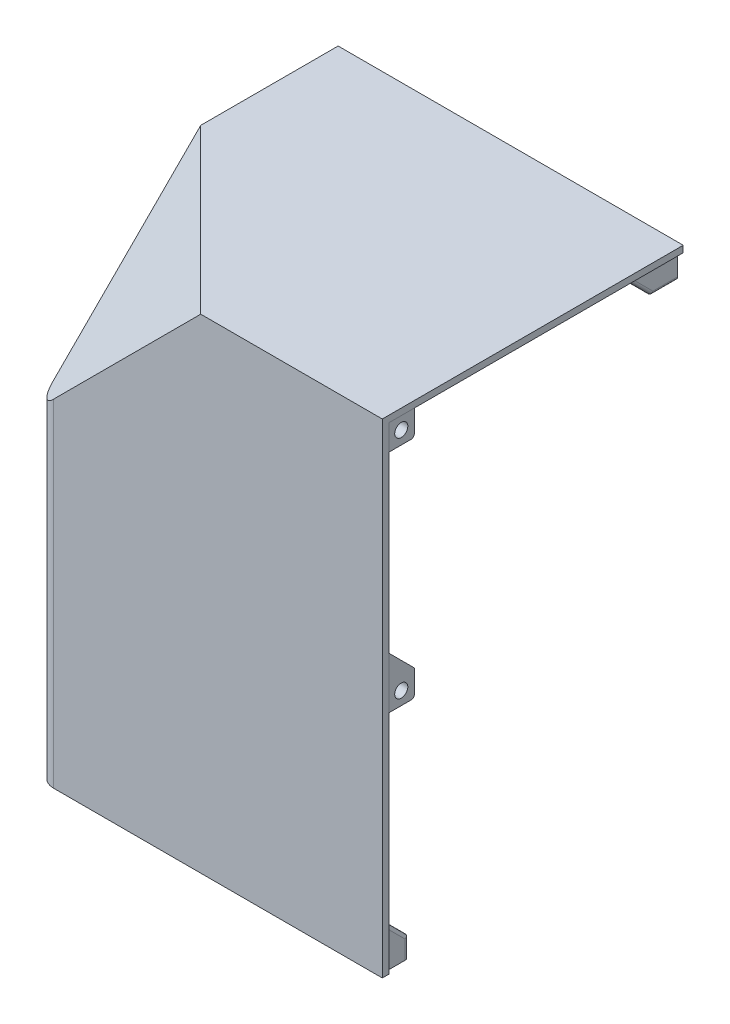
from build123d import *

# Parameters (mm, degrees)
BOSS_EXTRUDE1_DEPTH       = 146
SKETCH2_W                 = 105.5
SKETCH2_H                 = 92
BOSS_EXTRUDE2_DEPTH       = 2
BOSS_EXTRUDE3_START       = -0.2
SKETCH3_W                 = 7
SKETCH3_H                 = 8
SKETCH3_R                 = 2
SKETCH3_W_2               = 8
BOSS_EXTRUDE3_DEPTH       = 6
SKETCH4_W                 = 8
SKETCH4_H                 = 8
BOSS_EXTRUDE4_DEPTH       = 8
SKETCH5_W                 = 8
SKETCH5_H                 = 77
CUT_EXTRUDE1_DEPTH        = 0.2
F_4_0MM_DOWEL_HOLE1_D     = 4
F_4_0MM_DOWEL_HOLE1_DEPTH = 7.8
CHAMFER2_SIZE             = 8
BOSS_EXTRUDE5_START       = -0.2
SKETCH9_W                 = 8
SKETCH9_H                 = 8
SKETCH9_R                 = 2
BOSS_EXTRUDE5_DEPTH       = 8
CHAMFER3_SIZE             = 8
CHAMFER1_SIZE             = 7
CHAMFER4_SIZE             = 7
FILLET1_R                 = 1
SKETCH15_R                = 50
CUT_EXTRUDE4_DEPTH        = 219.937395923
BOSS_EXTRUDE7_DEPTH       = 3
FILLET2_R                 = 5


# Some blends are built 0.0001 mm under size
with BuildPart() as part:
    # Sketch1 → Boss-Extrude1 (new body)
    with BuildSketch(Plane(origin=(0, 0, 0), x_dir=(1, 0, 0), z_dir=(0, 1, 0))):
        Polygon((0, 0), (105.5, 0), (105.5, 2), (2, 2), (2, 92), (0, 92), align=None)
    extrude(amount=BOSS_EXTRUDE1_DEPTH)

    # Sketch2 → Boss-Extrude2 (add)
    with BuildSketch(Plane(origin=(0, 146, 0), x_dir=(1, 0, 0), z_dir=(0, 1, 0))):
        with Locations((52.75, 46)):
            Rectangle(SKETCH2_W, SKETCH2_H)
    extrude(amount=BOSS_EXTRUDE2_DEPTH)

    # Sketch3 → Boss-Extrude3 (add)
    # profile 1 of 3: a face of its own
    with BuildSketch(Plane.XZ.offset(BOSS_EXTRUDE3_START)):
        with Locations((5.5, -80)):
            Rectangle(SKETCH3_W, SKETCH3_H)
        with Locations(Location((5, -80, 0), (0, 0, 270))):
            Circle(SKETCH3_R, mode=Mode.SUBTRACT)
    # profile 2 of 3: a face of its own
    with BuildSketch(Plane.XZ.offset(BOSS_EXTRUDE3_START)):
        with Locations((5, -5)):
            Rectangle(SKETCH3_W_2, SKETCH3_H)
        with Locations(Location((5, -5, 0), (0, 0, 270))):
            Circle(SKETCH3_R, mode=Mode.SUBTRACT)
    # profile 3 of 3: a face of its own
    with BuildSketch(Plane.XZ.offset(BOSS_EXTRUDE3_START)):
        with Locations((100.5, -5)):
            Rectangle(SKETCH3_W_2, SKETCH3_H)
        with Locations(Location((100.5, -5, 0), (0, 0, 270))):
            Circle(SKETCH3_R, mode=Mode.SUBTRACT)
    extrude(amount=-BOSS_EXTRUDE3_DEPTH)

    # Sketch4 → Boss-Extrude4 (add)
    with BuildSketch(Plane(origin=(0, 0, -2), x_dir=(-1, 0, 0), z_dir=(0, 0, -1))):
        with Locations((-101.5, 73)):
            Rectangle(SKETCH4_W, SKETCH4_H)
        with Locations((-101.5, 142)):
            Rectangle(SKETCH4_W, SKETCH4_H)
    extrude(amount=BOSS_EXTRUDE4_DEPTH)

    # Sketch5 → Cut-Extrude1 (cut)
    with BuildSketch(Plane(origin=(105.5, 0, 0), x_dir=(0, 0, -1), z_dir=(1, 0, 0))):
        with Locations((6, 107.5)):
            Rectangle(SKETCH5_W, SKETCH5_H)
    extrude(amount=-CUT_EXTRUDE1_DEPTH, mode=Mode.SUBTRACT)

    # Ø4.0mm Dowel Hole1
    with Locations(Plane(origin=(105.3, 0, 0), x_dir=(0, 0, -1), z_dir=(1, 0, 0))):
        with Locations((6, 142), (6, 73)):
            Hole(F_4_0MM_DOWEL_HOLE1_D / 2, depth=F_4_0MM_DOWEL_HOLE1_DEPTH)

    # Chamfer2
    # the kernel refuses this chamfer: 8 mm, written as the material it adds along each edge
    with BuildSketch(Plane(origin=(97.5, 138, -2), x_dir=(-0.9996219169112968, 0, 0.02749587661058654), z_dir=(0, 1, 0))) as chamfer2_piece_1_section:
        Polygon((CHAMFER2_SIZE * 0.999621916911, -CHAMFER2_SIZE * 0.0274958766106), (-CHAMFER2_SIZE * 0.0274958766106, -CHAMFER2_SIZE * 0.999621916911), (0, 0), align=None)
    chamfer2_piece_1 = extrude(amount=8, mode=Mode.PRIVATE)
    chamfer2_piece_1 = split(chamfer2_piece_1, bisect_by=Plane(origin=(90.688027192, 144.666666667, -10), z_dir=(0, 0, 1)), keep=Keep.TOP, mode=Mode.PRIVATE)
    chamfer2_piece_1 = chamfer2_piece_1 - Plane(origin=(90.688027192, 142, -6), x_dir=(0, 0, 1), z_dir=(-1, 0, 0)) * Cylinder(2, 48, mode=Mode.PRIVATE)
    add(chamfer2_piece_1)
    with BuildSketch(Plane(origin=(97.5, 69, -2), x_dir=(-0.9996219169112968, 0, 0.02749587661058654), z_dir=(0, 1, 0))) as chamfer2_piece_2_section:
        Polygon((CHAMFER2_SIZE * 0.999621916911, -CHAMFER2_SIZE * 0.0274958766106), (-CHAMFER2_SIZE * 0.0274958766106, -CHAMFER2_SIZE * 0.999621916911), (0, 0), align=None)
    chamfer2_piece_2 = extrude(amount=8, mode=Mode.PRIVATE)
    chamfer2_piece_2 = split(chamfer2_piece_2, bisect_by=Plane(origin=(90.688027192, 75.666666667, -10), z_dir=(0, 0, 1)), keep=Keep.TOP, mode=Mode.PRIVATE)
    chamfer2_piece_2 = chamfer2_piece_2 - Plane(origin=(90.688027192, 73, -6), x_dir=(0, 0, 1), z_dir=(-1, 0, 0)) * Cylinder(2, 48, mode=Mode.PRIVATE)
    add(chamfer2_piece_2)

    # Sketch9 → Boss-Extrude5 (add)
    # profile 1 of 3: a face of its own
    with BuildSketch(Plane(origin=(0, 0, -92), x_dir=(-1, 0, 0), z_dir=(0, 0, -1)).offset(BOSS_EXTRUDE5_START)):
        with Locations((-6, 142)):
            Rectangle(SKETCH9_W, SKETCH9_H)
        with Locations((-6, 142)):
            Circle(SKETCH9_R, mode=Mode.SUBTRACT)
    # profile 2 of 3: a face of its own
    with BuildSketch(Plane(origin=(0, 0, -92), x_dir=(-1, 0, 0), z_dir=(0, 0, -1)).offset(BOSS_EXTRUDE5_START)):
        with Locations((-100, 142)):
            Rectangle(SKETCH9_W, SKETCH9_H)
        with Locations((-100, 142)):
            Circle(SKETCH9_R, mode=Mode.SUBTRACT)
    # profile 3 of 3: a face of its own
    with BuildSketch(Plane(origin=(0, 0, -92), x_dir=(-1, 0, 0), z_dir=(0, 0, -1)).offset(BOSS_EXTRUDE5_START)):
        with Locations((-6, 82)):
            Rectangle(SKETCH9_W, SKETCH9_H)
        with Locations((-6, 82)):
            Circle(SKETCH9_R, mode=Mode.SUBTRACT)
    extrude(amount=-BOSS_EXTRUDE5_DEPTH)

    # Chamfer3
    # the kernel refuses this chamfer: 8 mm, written as the material it adds along each edge
    with BuildSketch(Plane(origin=(2, 146, -83.8), x_dir=(0, 0.027495876610585647, 0.9996219169112968), z_dir=(1, 0, 0))) as chamfer3_piece_1_section:
        Polygon((CHAMFER3_SIZE * 0.999621916911, CHAMFER3_SIZE * 0.0274958766106), (-CHAMFER3_SIZE * 0.0274958766106, CHAMFER3_SIZE * 0.999621916911), (0, 0), align=None)
    chamfer3_piece_1 = extrude(amount=8, mode=Mode.PRIVATE)
    chamfer3_piece_1 = split(chamfer3_piece_1, bisect_by=Plane(origin=(8.666666667, 138, -76.988027286), z_dir=(0, 1, 0)), keep=Keep.TOP, mode=Mode.PRIVATE)
    chamfer3_piece_1 = chamfer3_piece_1 - Plane(origin=(6, 142, -76.988027286), x_dir=(-1, 0, 0), z_dir=(0, 0, -1)) * Cylinder(2, 48, mode=Mode.PRIVATE)
    add(chamfer3_piece_1)
    with BuildSketch(Plane(origin=(104, 146, -83.8), x_dir=(0, 0.027495876610585647, 0.9996219169112968), z_dir=(-1, 0, 0))) as chamfer3_piece_2_section:
        Polygon((CHAMFER3_SIZE * 0.999621916911, -CHAMFER3_SIZE * 0.0274958766106), (-CHAMFER3_SIZE * 0.0274958766106, -CHAMFER3_SIZE * 0.999621916911), (0, 0), align=None)
    chamfer3_piece_2 = extrude(amount=8, mode=Mode.PRIVATE)
    chamfer3_piece_2 = split(chamfer3_piece_2, bisect_by=Plane(origin=(97.333333333, 138, -76.988027286), z_dir=(0, 1, 0)), keep=Keep.TOP, mode=Mode.PRIVATE)
    chamfer3_piece_2 = chamfer3_piece_2 - Plane(origin=(100, 142, -76.988027286), x_dir=(-1, 0, 0), z_dir=(0, 0, -1)) * Cylinder(2, 48, mode=Mode.PRIVATE)
    add(chamfer3_piece_2)
    with BuildSketch(Plane(origin=(105.3, 77, -2), x_dir=(7.35283608460706e-15, 0.9996219169112968, 0.02749587661058559), z_dir=(-1, 0, 0))) as chamfer3_piece_3_section:
        Polygon((CHAMFER3_SIZE * 0.999621916911, CHAMFER3_SIZE * 0.0274958766106), (-CHAMFER3_SIZE * 0.0274958766106, CHAMFER3_SIZE * 0.999621916911), (0, 0), align=None)
    chamfer3_piece_3 = extrude(amount=36.373463904, mode=Mode.PRIVATE)
    chamfer3_piece_3 = split(chamfer3_piece_3, bisect_by=Plane(origin=(95.192873565, 79.806448266, -7.692873565), z_dir=(0.7071067811868302, 0, 0.7071067811862649)), keep=Keep.TOP, mode=Mode.PRIVATE)
    chamfer3_piece_3 = split(chamfer3_piece_3, bisect_by=Plane(origin=(98.56191571, 79.806448266, -10), z_dir=(0, 0, 1)), keep=Keep.TOP, mode=Mode.PRIVATE)
    add(chamfer3_piece_3)

    # Chamfer1
    chamfer1_edges = [part.edges().sort_by_distance(p)[0] for p in [
        (2, 86, -87.8),
    ]]
    chamfer(chamfer1_edges, length=CHAMFER1_SIZE)
    # the kernel refuses this chamfer: 7 mm, written as the material it adds along each edge
    with BuildSketch(Plane(origin=(104.5, 6.2, -2), x_dir=(0, 0.9996219169112968, 0.02749587661058637), z_dir=(-1, 0, 0))) as chamfer1_2_piece_1_section:
        with BuildLine():
            Line((7.200712366, 0), (-0.395830084, 7.189824555))
            Line((-0.395830084, 7.189824555), (-0.535777153, 7.185975132))
            ThreePointArc((-0.535777153, 7.185975132), (-0.238904589, 3.593784808), (-0.139947068, -0.003849423))
            Line((-0.139947068, -0.003849423), (0.003849423, -0.139947068))
            ThreePointArc((0.003849423, -0.139947068), (3.601483653, -0.040989547), (7.204561789, -0.139947068))
            Line((7.204561789, -0.139947068), (7.200712366, 0))
        make_face()
    chamfer1_2_piece_1 = extrude(amount=8, mode=Mode.PRIVATE)
    chamfer1_2_piece_1 = split(chamfer1_2_piece_1, bisect_by=Plane(origin=(97.833333333, 12.159669312, -9), z_dir=(0, 0, 1)), keep=Keep.TOP, mode=Mode.PRIVATE)
    chamfer1_2_piece_1 = chamfer1_2_piece_1 - Plane(origin=(100.5, 12.159669312, -5), x_dir=(0, 0, -1), z_dir=(0, -1, 0)) * Cylinder(2, 45, mode=Mode.PRIVATE)
    add(chamfer1_2_piece_1)
    # the kernel refuses this chamfer: 7 mm, written as the material it adds along each edge
    with BuildSketch(Plane(origin=(2, 6.2, -84), x_dir=(-0.027495876610586556, 0.9996219169112968, 0), z_dir=(0, 0, 1))) as chamfer1_3_piece_1_section:
        with BuildLine():
            Line((7.200712366, 0), (-0.395830084, -7.189824555))
            Line((-0.395830084, -7.189824555), (-0.535777153, -7.185975132))
            ThreePointArc((-0.535777153, -7.185975132), (-0.238904589, -3.593784808), (-0.139947068, 0.003849423))
            Line((-0.139947068, 0.003849423), (0.003849423, 0.139947068))
            ThreePointArc((0.003849423, 0.139947068), (3.601483653, 0.040989547), (7.204561789, 0.139947068))
            Line((7.204561789, 0.139947068), (7.200712366, 0))
        make_face()
    chamfer1_3_piece_1 = extrude(amount=8, mode=Mode.PRIVATE)
    chamfer1_3_piece_1 = split(chamfer1_3_piece_1, bisect_by=Plane(origin=(9, 12.159669426, -77.333333333), z_dir=(-1, 0, 0)), keep=Keep.TOP, mode=Mode.PRIVATE)
    chamfer1_3_piece_1 = chamfer1_3_piece_1 - Plane(origin=(5, 12.159669426, -80), x_dir=(0, 0, -1), z_dir=(0, -1, 0)) * Cylinder(2, 45, mode=Mode.PRIVATE)
    add(chamfer1_3_piece_1)
    # the kernel refuses this chamfer: 7 mm, written as the material it adds along each edge
    with BuildSketch(Plane(origin=(2, 6.2, -2), x_dir=(-0.02749587661058637, 0.9996219169112968, 0), z_dir=(0, 0, -1))) as chamfer1_4_piece_1_section:
        with BuildLine():
            Line((7.200712366, 0), (-0.395830084, 7.189824555))
            Line((-0.395830084, 7.189824555), (-0.535777153, 7.185975132))
            ThreePointArc((-0.535777153, 7.185975132), (-0.238904589, 3.593784808), (-0.139947068, -0.003849423))
            Line((-0.139947068, -0.003849423), (0.003849423, -0.139947068))
            ThreePointArc((0.003849423, -0.139947068), (3.601483653, -0.040989547), (7.204561789, -0.139947068))
            Line((7.204561789, -0.139947068), (7.200712366, 0))
        make_face()
    chamfer1_4_piece_1 = extrude(amount=7, mode=Mode.PRIVATE)
    chamfer1_4_piece_1 = split(chamfer1_4_piece_1, bisect_by=Plane(origin=(9, 12.161920808, -7.833333333), z_dir=(-1, 0, 0)), keep=Keep.TOP, mode=Mode.PRIVATE)
    chamfer1_4_piece_1 = chamfer1_4_piece_1 - Plane(origin=(5, 12.161920808, -5), x_dir=(0, 0, -1), z_dir=(0, -1, 0)) * Cylinder(2, 43, mode=Mode.PRIVATE)
    add(chamfer1_4_piece_1)

    # Chamfer4
    # the kernel refuses this chamfer: 7 mm, written as the material it adds along each edge
    with BuildSketch(Plane(origin=(2, 31.201780916, -76), x_dir=(-0.027495876610586403, -2.1873373005352424e-15, 0.9996219169112968), z_dir=(0, -1, 0))) as chamfer4_piece_1_section:
        Polygon((CHAMFER4_SIZE * 0.999621916911, -CHAMFER4_SIZE * 0.0274958766106), (-CHAMFER4_SIZE * 0.0274958766106, -CHAMFER4_SIZE * 0.999621916911), (0, 0), align=None)
    chamfer4_piece_1 = extrude(amount=31.001780916, mode=Mode.PRIVATE)
    chamfer4_piece_1 = split(chamfer4_piece_1, bisect_by=Plane(origin=(6.759568818, 8.440431182, -73.53334602), z_dir=(-0.707106781186299, -0.7071067811867962, 0)), keep=Keep.TOP, mode=Mode.PRIVATE)
    chamfer4_piece_1 = split(chamfer4_piece_1, bisect_by=Plane(origin=(9, 5.693620788, -73.53334602), z_dir=(-1, 0, 0)), keep=Keep.TOP, mode=Mode.PRIVATE)
    add(chamfer4_piece_1)
    with BuildSketch(Plane(origin=(96.5, 0.2, -2), x_dir=(-0.9996219169112968, 4.370447847260361e-15, 0.02749587661058656), z_dir=(0, 1, 0))) as chamfer4_piece_2_section:
        Polygon((CHAMFER4_SIZE * 0.999621916911, -CHAMFER4_SIZE * 0.0274958766106), (-CHAMFER4_SIZE * 0.0274958766106, -CHAMFER4_SIZE * 0.999621916911), (0, 0), align=None)
    chamfer4_piece_2 = extrude(amount=31.001780916, mode=Mode.PRIVATE)
    chamfer4_piece_2 = split(chamfer4_piece_2, bisect_by=Plane(origin=(94.03334602, 8.440431182, -6.759568818), z_dir=(0, -0.7071067811867962, 0.707106781186299)), keep=Keep.TOP, mode=Mode.PRIVATE)
    chamfer4_piece_2 = split(chamfer4_piece_2, bisect_by=Plane(origin=(94.03334602, 5.693620788, -9), z_dir=(0, 0, 1)), keep=Keep.TOP, mode=Mode.PRIVATE)
    add(chamfer4_piece_2)
    with BuildSketch(Plane(origin=(96, 146, -91.8), x_dir=(-0.9996219169112968, 0.027495876610586126, -1.967830739555515e-15), z_dir=(0, 0, 1))) as chamfer4_piece_3_section:
        Polygon((CHAMFER4_SIZE * 0.999621916911, CHAMFER4_SIZE * 0.0274958766106), (-CHAMFER4_SIZE * 0.0274958766106, CHAMFER4_SIZE * 0.999621916911), (0, 0), align=None)
    chamfer4_piece_3 = extrude(amount=34.001780916, mode=Mode.PRIVATE)
    chamfer4_piece_3 = split(chamfer4_piece_3, bisect_by=Plane(origin=(93.569946265, 140.439034316, -81.360965684), z_dir=(0, 0.7071067811862649, -0.7071067811868302)), keep=Keep.TOP, mode=Mode.PRIVATE)
    add(chamfer4_piece_3)
    with BuildSketch(Plane(origin=(2, 78, -83.8), x_dir=(-0.027495876610586497, 0, 0.9996219169112968), z_dir=(0, 1, 0))) as chamfer4_piece_4_section:
        Polygon((CHAMFER4_SIZE * 0.999621916911, CHAMFER4_SIZE * 0.0274958766106), (-CHAMFER4_SIZE * 0.0274958766106, CHAMFER4_SIZE * 0.999621916911), (0, 0), align=None)
    chamfer4_piece_4 = extrude(amount=33.001780916, mode=Mode.PRIVATE)
    chamfer4_piece_4 = split(chamfer4_piece_4, bisect_by=Plane(origin=(8.497935299, 86.502064701, -81.32656752), z_dir=(-0.7071067811865476, -0.7071067811865476, 0)), keep=Keep.TOP, mode=Mode.PRIVATE)
    chamfer4_piece_4 = split(chamfer4_piece_4, bisect_by=Plane(origin=(3.995792094, 86, -81.32656752), z_dir=(0, -1, 0)), keep=Keep.TOP, mode=Mode.PRIVATE)
    chamfer4_piece_4 = chamfer4_piece_4 - Plane(origin=(6, 82, -81.32656752), x_dir=(-1, 0, 0), z_dir=(0, 0, -1)) * Cylinder(2, 94, mode=Mode.PRIVATE)
    add(chamfer4_piece_4)
    with BuildSketch(Plane(origin=(2, 78, -83.8), x_dir=(-0.027495876610586497, 0, 0.9996219169112968), z_dir=(0, 1, 0))) as chamfer4_piece_5_section:
        Polygon((CHAMFER4_SIZE * 0.999621916911, CHAMFER4_SIZE * 0.0274958766106), (-CHAMFER4_SIZE * 0.0274958766106, CHAMFER4_SIZE * 0.999621916911), (0, 0), align=None)
    chamfer4_piece_5 = extrude(amount=33.001780916, mode=Mode.PRIVATE)
    chamfer4_piece_5 = split(chamfer4_piece_5, bisect_by=Plane(origin=(4.984102881, 90.015897119, -81.136955408), z_dir=(-0.7071067811865476, -0.7071067811865476, 0)), keep=Keep.TOP, mode=Mode.PRIVATE)
    chamfer4_piece_5 = split(chamfer4_piece_5, bisect_by=Plane(origin=(3.645470507, 86, -81.136955408), z_dir=(0, 1, 0)), keep=Keep.TOP, mode=Mode.PRIVATE)
    add(chamfer4_piece_5)

    # Fillet1
    fillet1_edges = [part.edges().sort_by_distance(p)[0] for p in [
        (9, 3.2, -84),
        (5.5, 9.7, -84),
        (9, 3.2, -9),
        (104.5, 3.2, -9),
        (104.5, 9.7, -5.5),
        (5.5, 9.7, -9),
        (93.5, 138, -6),
        (101.4, 138, -10),
        (101.4, 69, -10),
        (93.5, 69, -6),
        (96, 138.5, -83.3),
        (96, 138, -87.8),
        (104, 142, -79.8),
        (104, 138, -87.8),
        (10, 142, -79.8),
        (10, 138, -87.8),
    ]]
    fillet(fillet1_edges, radius=FILLET1_R - 0.0001)  # a hair under: the kernel refuses the full size

    # Sketch15 → Cut-Extrude4 (cut, through all)
    with BuildSketch(Plane(origin=(-32.666666667, 32.666666667, 32.666666667), x_dir=(0.8164965809277261, 0.408248290463863, 0.408248290463863), z_dir=(-0.5773502691896257, 0.5773502691896258, 0.5773502691896258))):
        with Locations((60.420746989, 104.651803616)):
            Circle(SKETCH15_R)
    extrude(amount=CUT_EXTRUDE4_DEPTH, mode=Mode.SUBTRACT)

    # Sketch16 → Boss-Extrude7 (add)
    with BuildSketch(Plane(origin=(-32.666666667, 32.666666667, 32.666666667), x_dir=(0.40824829046386274, -0.40824829046386296, 0.8164965809277264), z_dir=(-0.5773502691896258, 0.5773502691896262, 0.5773502691896255))):
        Polygon((-101.245576035, 104.651803616), (-40.008332465, 69.296464556), (-40.008332465, 140.007142675), align=None)
    extrude(amount=-BOSS_EXTRUDE7_DEPTH)

    # Fillet2
    fillet2_edges = [part.edges().sort_by_distance(p)[0] for p in [
        (0, 49, 0),
    ]]
    fillet(fillet2_edges, radius=FILLET2_R)


solid = part.part
